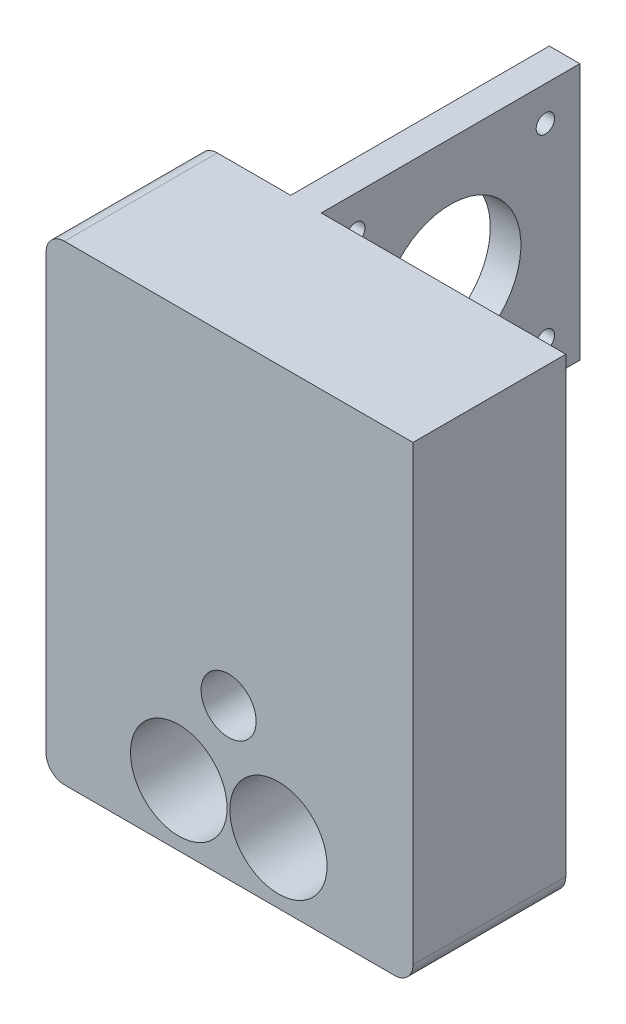
from build123d import *

# Parameters (mm, degrees)
ESQUISSE1_W              = 100
ESQUISSE1_H              = 100
BOSS_EXTRU_1_DEPTH       = 25
ESQUISSE2_R              = 7.9
ESQUISSE2_R_2            = 7.95
ESQUISSE2_R_3            = 4.5
ENL_V_MAT_EXTRU_1_DEPTH  = 144.614066163
ESQUISSE3_R              = 4.3
ENL_V_MAT_EXTRU_3_DEPTH  = 10
ESQUISSE4_W              = 5
ESQUISSE4_H              = 42
BOSS_EXTRU_2_DEPTH       = 42.3
ESQUISSE5_R              = 1.5
ENL_V_MAT_EXTRU_4_DEPTH  = 12
ESQUISSE6_W              = 40
ESQUISSE6_H              = 100
ENL_V_MAT_EXTRU_6_DEPTH  = 148.61195751
ENL_V_MAT_EXTRU_8_DEPTH  = 7.5
ESQUISSE9_W              = 60
ESQUISSE9_H              = 23
ENL_V_MAT_EXTRU_9_DEPTH  = 148.61195751
CONG_2_R                 = 3
ESQUISSE10_R             = 11.5
ENL_V_MAT_EXTRU_10_DEPTH = 99.708105037


with BuildPart() as part:
    # Esquisse1 → Boss.-Extru.1 (new body)
    with BuildSketch(Plane.XY):
        with Locations((50, 50)):
            Rectangle(ESQUISSE1_W, ESQUISSE1_H)
    extrude(amount=BOSS_EXTRU_1_DEPTH)

    # Esquisse2 → Enlèv. mat.-Extru.1 (cut, through all)
    with BuildSketch(Plane.XY):
        with Locations((61.7000009, 9.994583957)):
            Circle(ESQUISSE2_R)
        with Locations((78, 10)):
            Circle(ESQUISSE2_R_2)
        with Locations((69.845134328, 24.642259589)):
            Circle(ESQUISSE2_R_3)
    extrude(amount=ENL_V_MAT_EXTRU_1_DEPTH, mode=Mode.SUBTRACT)

    # Esquisse3 → Enlèv. mat.-Extru.3 (cut)
    with BuildSketch(Plane(origin=(0, 0, 0), x_dir=(1, 0, 0), z_dir=(0, 1, 0))):
        with Locations((48, -12.5)):
            Circle(ESQUISSE3_R)
        with Locations((92, -12.5)):
            Circle(ESQUISSE3_R)
    extrude(amount=ENL_V_MAT_EXTRU_3_DEPTH, mode=Mode.SUBTRACT)

    # Esquisse4 → Boss.-Extru.2 (add)
    with BuildSketch(Plane.XY):
        with Locations((57.5, 56)):
            Rectangle(ESQUISSE4_W, ESQUISSE4_H)
    extrude(amount=-BOSS_EXTRU_2_DEPTH)

    # Esquisse5 → Enlèv. mat.-Extru.4 (cut)
    with BuildSketch(Plane(origin=(60, 0, 0), x_dir=(0, 0, -1), z_dir=(1, 0, 0))):
        with Locations((36.65, 71.35)):
            Circle(ESQUISSE5_R)
        with Locations((36.65, 40.65)):
            Circle(ESQUISSE5_R)
        with Locations((5.65, 40.65)):
            Circle(ESQUISSE5_R)
        with Locations((5.65, 71.35)):
            Circle(ESQUISSE5_R)
    extrude(amount=-ENL_V_MAT_EXTRU_4_DEPTH, mode=Mode.SUBTRACT)

    # Esquisse6 → Enlèv. mat.-Extru.6 (cut, through all)
    with BuildSketch(Plane.XY):
        with Locations((20, 50)):
            Rectangle(ESQUISSE6_W, ESQUISSE6_H)
    extrude(amount=ENL_V_MAT_EXTRU_6_DEPTH, mode=Mode.SUBTRACT)

    # Esquisse8 → Enlèv. mat.-Extru.8 (cut)
    with BuildSketch(Plane(origin=(0, 0, 0), x_dir=(-1, 0, 0), z_dir=(0, 0, -1))):
        Polygon((-62.690994399, 21.852704928), (-63.852239162, 29.44314918), (-71.006379091, 32.232703841), (-76.999274258, 27.43181425), (-75.838029495, 19.841369999), (-68.683889565, 17.051815338), align=None)
    extrude(amount=-ENL_V_MAT_EXTRU_8_DEPTH, mode=Mode.SUBTRACT)

    # Esquisse9 → Enlèv. mat.-Extru.9 (cut, through all)
    with BuildSketch(Plane(origin=(0, 0, 0), x_dir=(-1, 0, 0), z_dir=(0, 0, -1))):
        with Locations((-70, 88.5)):
            Rectangle(ESQUISSE9_W, ESQUISSE9_H)
    extrude(amount=-ENL_V_MAT_EXTRU_9_DEPTH, mode=Mode.SUBTRACT)

    # Congé2
    cong_2_edges = [part.edges().sort_by_distance(p)[0] for p in [
        (100, 0, 12.5),
        (40, 77, 12.5),
        (40, 0, 12.5),
    ]]
    fillet(cong_2_edges, radius=CONG_2_R)

    # Esquisse10 → Enlèv. mat.-Extru.10 (cut, through all)
    with BuildSketch(Plane.ZY.offset(-55)):
        with Locations((-21.15, 56.15)):
            Circle(ESQUISSE10_R)
    extrude(amount=-ENL_V_MAT_EXTRU_10_DEPTH, mode=Mode.SUBTRACT)


solid = part.part
